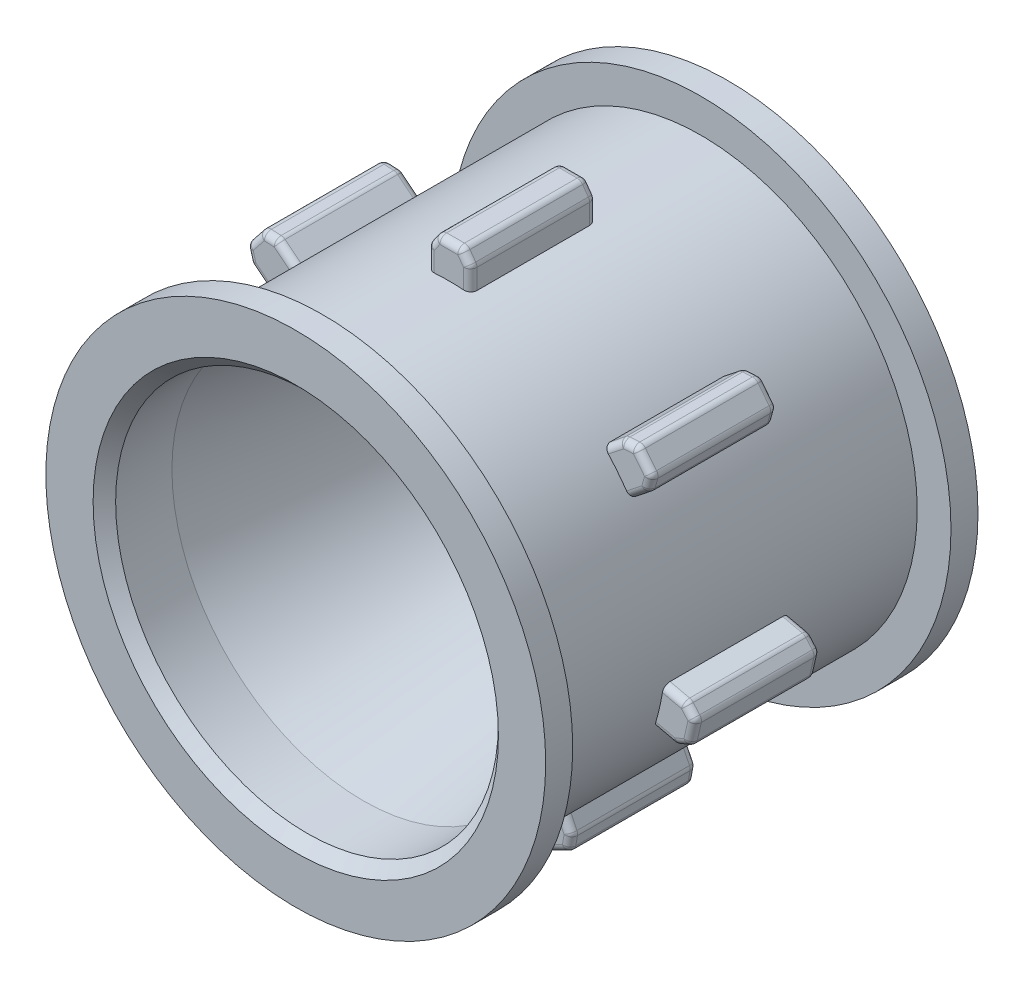
from build123d import *
from OCP.BRepFilletAPI import BRepFilletAPI_MakeChamfer

# Parameters (mm, degrees)
LAUFRAD_DEPTH                   = 8.4
LAUFRAD_DEPTH_BACK              = 8.4
SKIZZE1_R                       = 9.6
SKIZZE2_R                       = 11.1
KETTENF_HRUNG_DEPTH             = 1.2
SKIZZE4_R                       = 1
SCHRAUBENBOHRUNG_M3_DEPTH       = 25.800403223
SKIZZE3_R                       = 4.1
KUGELLAGERSITZ_DEPTH            = 2
FASE1_SIZE                      = 0.1
ZAHN_DEPTH                      = 2.8
VERRUNDUNG1_R                   = 0.3
KREISMUSTER1_COUNT              = 7
VERRUNDUNG1_OF_KREISMUSTER1_R   = 0.3
SKIZZE8_W                       = 4
SKIZZE8_H                       = 17
AUSCHNITT_ANTRIEB_WAGE_DEPTH    = 2
SKIZZE10_W                      = 17
SKIZZE10_H                      = 7
SCHNITT_LINEAR_AUSTRAGEN2_DEPTH = 2
FASE2_SIZE                      = 0.5
FASE2_SIZE2                     = 0.621706886


with BuildPart() as part:
    # Skizze1 → Laufrad (new, two sides: drawn at the far end of the back side and taken through both)
    with BuildSketch(Plane.XY.offset(-LAUFRAD_DEPTH_BACK)):
        Circle(SKIZZE1_R)
    extrude(amount=LAUFRAD_DEPTH + LAUFRAD_DEPTH_BACK)

    # Skizze2 → Kettenführung (add)
    with BuildSketch(Plane.XY.offset(8.4)):
        Circle(SKIZZE2_R)
    kettenf_hrung = extrude(amount=KETTENF_HRUNG_DEPTH)

    # Spiegeln Kettenführung: Kettenführung across plane
    add(kettenf_hrung.mirror(Plane.XY))

    # Skizze4 → SchraubenBohrung M3 (cut, through all)
    with BuildSketch(Plane(origin=(0, 0, -9.6), x_dir=(-1, 0, 0), z_dir=(0, 0, -1))):
        Circle(SKIZZE4_R)
    extrude(amount=-SCHRAUBENBOHRUNG_M3_DEPTH, mode=Mode.SUBTRACT)

    # Skizze3 → Kugellagersitz (cut)
    with BuildSketch(Plane(origin=(0, 0, -9.6), x_dir=(-1, 0, 0), z_dir=(0, 0, -1))):
        Circle(SKIZZE3_R)
    extrude(amount=-KUGELLAGERSITZ_DEPTH, mode=Mode.SUBTRACT)

    # Skizze5 → Schnitt-Rotation3 (revolve, cut)
    with BuildSketch(Plane(origin=(0, 0, 0), x_dir=(0, 0, -1), z_dir=(1, 0, 0))):
        Polygon((-9.6, 0), (-9.6, 8.5), (-6.6, 8.5), (7.1, 6), (7.1, 0), align=None)
    revolve(axis=Axis((0, 0, -8.4), (0, 0, 1)), mode=Mode.SUBTRACT)

    # Fase1
    fase1_edges = [part.edges().sort_by_distance(p)[0] for p in [
        (1, 0, -7.1),
    ]]
    chamfer(fase1_edges, length=FASE1_SIZE)

    # Skizze6 → Zahn (add, symmetric)
    with BuildSketch(Plane.XY):
        Polygon((0.55, 11.1), (-0.55, 11.1), (-0.95, 10.542409848), (-0.95, 9.552879147), (0.95, 9.552879147), (0.95, 10.542409848), align=None)
    zahn = extrude(amount=ZAHN_DEPTH, both=True)

    # Verrundung1
    verrundung1_edges = [part.edges().sort_by_distance(p)[0] for p in [
        (0.95, 10.542409848, 0),
        (-0.95, 10.542409848, 0),
        (-0.95, 10.047644498, -2.8),
        (-0.75, 10.821204924, -2.8),
        (0, 11.1, -2.8),
        (0.75, 10.821204924, -2.8),
        (0.95, 10.047644498, -2.8),
        (-0.55, 11.1, 0),
        (0.55, 11.1, 0),
        (-0.95, 10.047644498, 2.8),
        (-0.75, 10.821204924, 2.8),
        (0, 11.1, 2.8),
        (0.75, 10.821204924, 2.8),
        (0.95, 10.047644498, 2.8),
    ]]
    fillet(verrundung1_edges, radius=VERRUNDUNG1_R)

    # Kreismuster1: Zahn ×7 about axis
    kreismuster1_axis = Axis((0, 0, -8.4), (0, 0, 1))
    for i in range(1, KREISMUSTER1_COUNT):
        add(zahn.rotate(kreismuster1_axis, i * 360 / KREISMUSTER1_COUNT))

    # Verrundung1 of Kreismuster1
    verrundung1_of_kreismuster1_edges = [part.edges().sort_by_distance(p)[0] for p in [
        (-7.650072609, 7.315824936, 0),
        (-8.834703232, 5.830345119, 0),
        (-8.447880105, 5.521863969, -2.8),
        (-8.927976039, 6.160537302, -2.8),
        (-8.678329455, 6.920736801, -2.8),
        (-7.992741337, 7.333284526, -2.8),
        (-7.263249481, 7.007343785, -2.8),
        (-9.021248846, 6.490729485, 0),
        (-8.335410064, 7.350744116, 0),
        (-8.447880105, 5.521863969, 2.8),
        (-8.927976039, 6.160537302, 2.8),
        (-8.678329455, 6.920736801, 2.8),
        (-7.992741337, 7.333284526, 2.8),
        (-7.263249481, 7.007343785, 2.8),
        (-10.48948451, -1.419725369, 0),
        (-10.066694735, -3.272088402, 0),
        (-9.584334185, -3.161992754, -2.8),
        (-10.383004023, -3.13914056, -2.8),
        (-10.821699825, -2.469982367, -2.8),
        (-10.716785424, -1.676748692, -2.8),
        (-10.00712396, -1.309629721, -2.8),
        (-10.699313312, -3.006192719, 0),
        (-10.944086339, -1.933772015, 0),
        (-9.584334185, -3.161992754, 2.8),
        (-10.383004023, -3.13914056, 2.8),
        (-10.821699825, -2.469982367, 2.8),
        (-10.716785424, -1.676748692, 2.8),
        (-10.00712396, -1.309629721, 2.8),
        (-5.430100629, -9.086193514, 0),
        (-3.71825978, -9.910572618, 0),
        (-3.503589139, -9.46480444, -2.8),
        (-4.019418203, -10.074981554, -2.8),
        (-4.816109504, -10.000754434, -2.8),
        (-5.370871505, -9.424155945, -2.8),
        (-5.215429988, -8.640425336, -2.8),
        (-4.320576627, -10.23939049, 0),
        (-5.311642382, -9.762118377, 0),
        (-3.503589139, -9.46480444, 2.8),
        (-4.019418203, -10.074981554, 2.8),
        (-4.816109504, -10.000754434, 2.8),
        (-5.370871505, -9.424155945, 2.8),
        (-5.215429988, -8.640425336, 2.8),
        (3.71825978, -9.910572618, 0),
        (5.430100629, -9.086193514, 0),
        (5.215429988, -8.640425336, -2.8),
        (5.370871505, -9.424155945, -2.8),
        (4.816109504, -10.000754434, -2.8),
        (4.019418203, -10.074981554, -2.8),
        (3.503589139, -9.46480444, -2.8),
        (5.311642382, -9.762118377, 0),
        (4.320576627, -10.23939049, 0),
        (5.215429988, -8.640425336, 2.8),
        (5.370871505, -9.424155945, 2.8),
        (4.816109504, -10.000754434, 2.8),
        (4.019418203, -10.074981554, 2.8),
        (3.503589139, -9.46480444, 2.8),
        (10.066694735, -3.272088402, 0),
        (10.48948451, -1.419725369, 0),
        (10.00712396, -1.309629721, -2.8),
        (10.716785424, -1.676748692, -2.8),
        (10.821699825, -2.469982367, -2.8),
        (10.383004023, -3.13914056, -2.8),
        (9.584334185, -3.161992754, -2.8),
        (10.944086339, -1.933772015, 0),
        (10.699313312, -3.006192719, 0),
        (10.00712396, -1.309629721, 2.8),
        (10.716785424, -1.676748692, 2.8),
        (10.821699825, -2.469982367, 2.8),
        (10.383004023, -3.13914056, 2.8),
        (9.584334185, -3.161992754, 2.8),
        (8.834703232, 5.830345119, 0),
        (7.650072609, 7.315824936, 0),
        (7.263249481, 7.007343785, -2.8),
        (7.992741337, 7.333284526, -2.8),
        (8.678329455, 6.920736801, -2.8),
        (8.927976039, 6.160537302, -2.8),
        (8.447880105, 5.521863969, -2.8),
        (8.335410064, 7.350744116, 0),
        (9.021248846, 6.490729485, 0),
        (7.263249481, 7.007343785, 2.8),
        (7.992741337, 7.333284526, 2.8),
        (8.678329455, 6.920736801, 2.8),
        (8.927976039, 6.160537302, 2.8),
        (8.447880105, 5.521863969, 2.8),
    ]]
    fillet(verrundung1_of_kreismuster1_edges, radius=VERRUNDUNG1_OF_KREISMUSTER1_R)

    # Skizze8 → Auschnitt Antrieb Wage (cut)
    with BuildSketch(Plane(origin=(0, 0, -9.6), x_dir=(-1, 0, 0), z_dir=(0, 0, -1))):
        Rectangle(SKIZZE8_W, SKIZZE8_H)
    extrude(amount=-AUSCHNITT_ANTRIEB_WAGE_DEPTH, mode=Mode.SUBTRACT)

    # Skizze10 → Schnitt-Linear austragen2 (cut)
    with BuildSketch(Plane(origin=(0, 0, -9.6), x_dir=(-1, 0, 0), z_dir=(0, 0, -1))):
        Rectangle(SKIZZE10_W, SKIZZE10_H)
    extrude(amount=-SCHNITT_LINEAR_AUSTRAGEN2_DEPTH, mode=Mode.SUBTRACT)

    # Fase2: one chamfer whose edges measure the first distance from different faces: ONE call of the kernel's chamfer builder (chamfer() names one face for all edges)
    fase2_edges_1 = [part.edges().sort_by_distance(p)[0] for p in [
        (0, -6, -7.1),
    ]]
    fase2_side_1 = [part.faces().sort_by_distance(p)[0] for p in [
        (1.269705627, 0, -7.1),
    ]]
    fase2_edges_2 = [part.edges().sort_by_distance(p)[0] for p in [
        (0, -8.5, 9.6),
    ]]
    fase2 = BRepFilletAPI_MakeChamfer(part.part.solid().wrapped)
    for e in fase2_edges_1:
        fase2.Add(FASE2_SIZE, FASE2_SIZE2, e.wrapped, fase2_side_1[0].wrapped)  # the first distance lies on this face
    for e in fase2_edges_2:
        fase2.Add(FASE2_SIZE, e.wrapped)
    add(Compound.cast(fase2.Shape()), mode=Mode.REPLACE)


solid = part.part
